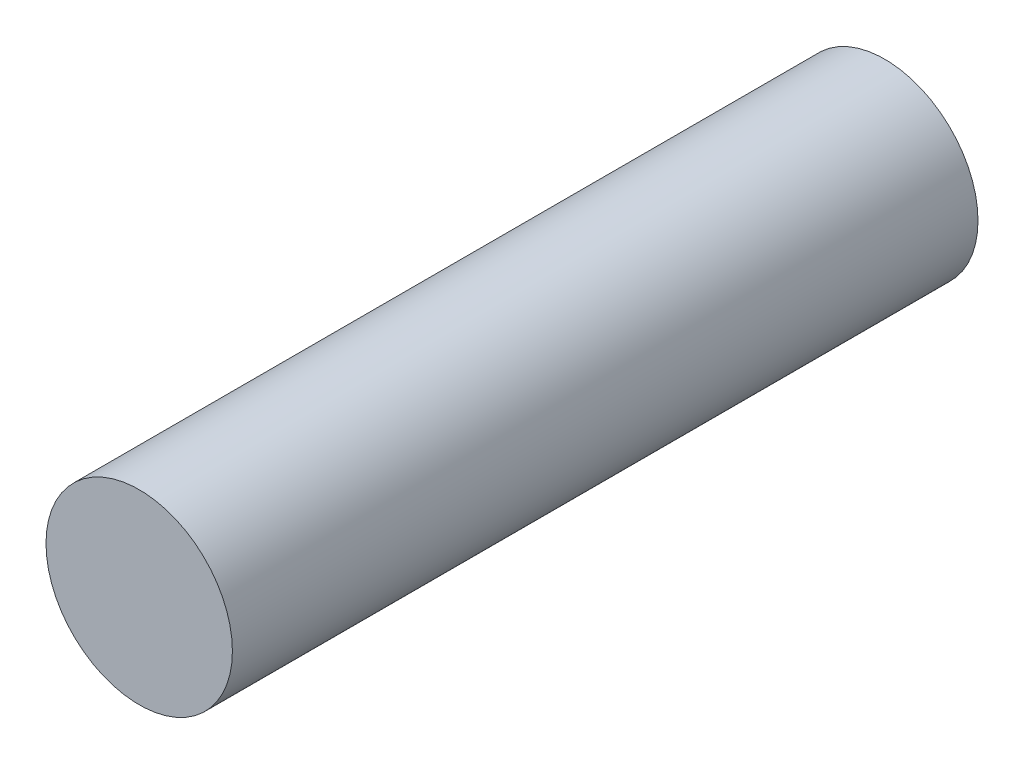
from build123d import *

# Parameters (mm, degrees)
SKETCH_1_R      = 25
EXTRUDE_1_DEPTH = 200


with BuildPart() as part:
    # 스케치1 → 보스-돌출1 (new body)
    with BuildSketch(Plane.XY):
        Circle(SKETCH_1_R)
    extrude(amount=EXTRUDE_1_DEPTH)


solid = part.part
